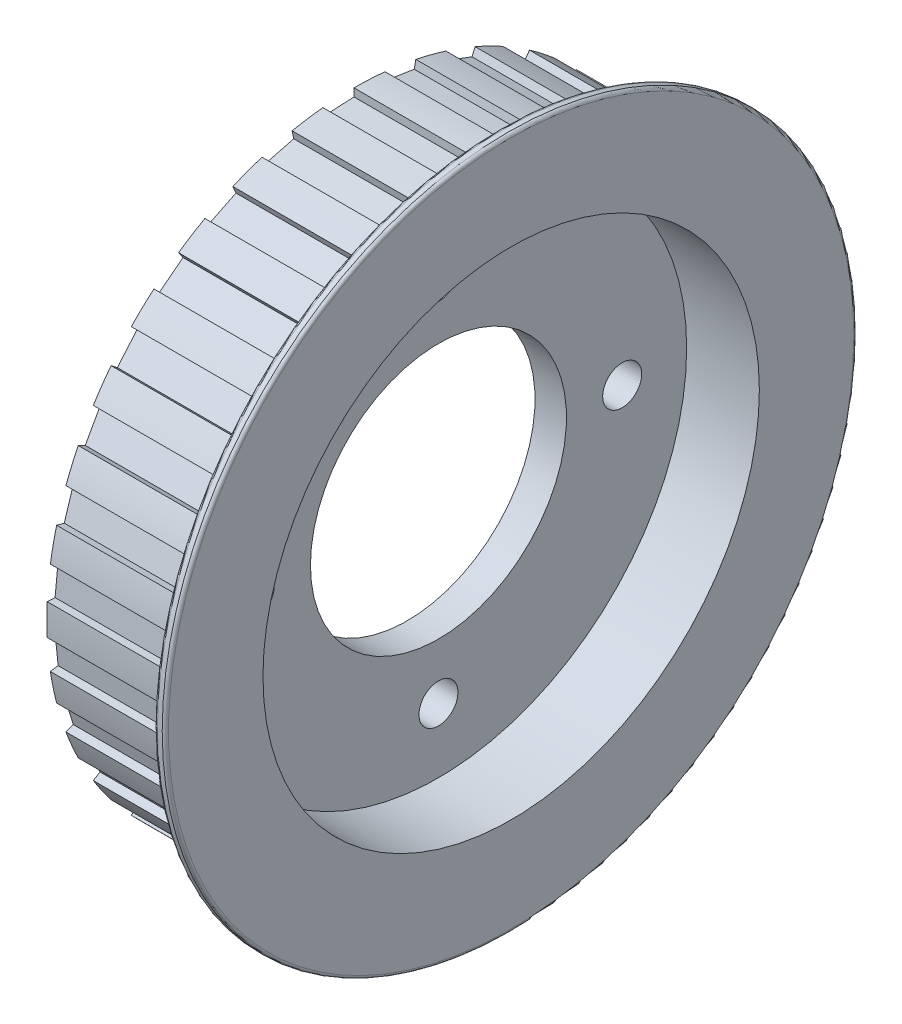
from build123d import *

# Parameters (mm, degrees)
BOSS_EXTRUDE1_START           = -0.79375
BOSS_EXTRUDE1_DEPTH           = 11.90625
BOSS_EXTRUDE1_START_2         = 5.55625
BOSS_EXTRUDE1_3_DEPTH         = 0.79375
SKETCH2_R                     = 27.94
BOSS_EXTRUDE2_DEPTH           = 0.79375
M36_CLEARANCE_HOLE1_D         = 40.1066
DRAFT1_ANGLE                  = 2.903225806
DRAFT2_ANGLE                  = 2.903225806
SKETCH6_W                     = 5.87375
SKETCH6_H                     = 6.962175295
SKETCH10_R                    = 20.0533
BOSS_EXTRUDE3_DEPTH           = 2.54
FILLET2_R                     = 0.0635
FILLET3_R                     = 0.254
RIM_START                     = -4.28625
RIM_RELIEF_SKETCH_R           = 20.7645
RIM_RELIEF_SKETCH_R_2         = 20.0533
RIM_RELIEF_CUT_DEPTH          = 4.28625
BOLT_HEAD_CLEARANCE_SKETCH_R  = 1.575
BOLT_HEAD_CLEARANCE_CUT_DEPTH = 42.503960762
BORE_SKETCH_R                 = 10.343388
BORE_CUT_DEPTH                = 42.503960762


with BuildPart() as part:
    # Boss-Extrude1: read off the stored shape, not the designer's step
    # Boss-Extrude1 outline → Boss-Extrude1 (new body)
    with BuildSketch(Plane.ZY.offset(-5.55625).offset(BOSS_EXTRUDE1_START)):
        with BuildLine():
            Line((-22.675596757, -8.398118858), (-21.70963201, -10.6490829))
            Line((-21.70963201, -10.6490829), (-22.279737893, -10.928733186))
            ThreePointArc((-22.279737893, -10.928733186), (-21.697610757, -12.043156442), (-21.059786165, -13.126665087))
            Line((-21.059786165, -13.126665087), (-20.520897062, -12.790772941))
            Line((-20.520897062, -12.790772941), (-19.12158994, -14.801212343))
            Line((-19.12158994, -14.801212343), (-19.623732533, -15.189899642))
            ThreePointArc((-19.623732533, -15.189899642), (-18.829189821, -16.164329257), (-17.986312849, -17.09726527))
            Line((-17.986312849, -17.09726527), (-17.526069429, -16.659771277))
            Line((-17.526069429, -16.659771277), (-15.75070773, -18.347378413))
            Line((-15.75070773, -18.347378413), (-16.164329257, -18.829189821))
            ThreePointArc((-16.164329257, -18.829189821), (-15.189899642, -19.623732533), (-14.176477772, -20.367901404))
            Line((-14.176477772, -20.367901404), (-13.813722456, -19.846716619))
            Line((-13.813722456, -19.846716619), (-11.734989696, -21.142400656))
            Line((-11.734989696, -21.142400656), (-12.043156442, -21.697610757))
            ThreePointArc((-12.043156442, -21.697610757), (-10.928733186, -22.279737893), (-9.786256029, -22.804673262))
            Line((-9.786256029, -22.804673262), (-9.535840061, -22.221135051))
            Line((-9.535840061, -22.221135051), (-7.238839804, -23.071850531))
            Line((-7.238839804, -23.071850531), (-7.428935387, -23.677728959))
            ThreePointArc((-7.428935387, -23.677728959), (-6.22014311, -24.023608166), (-4.995383815, -24.307819116))
            Line((-4.995383815, -24.307819116), (-4.867559255, -23.685817603))
            Line((-4.867559255, -23.685817603), (-2.44633096, -24.056736135))
            Line((-2.44633096, -24.056736135), (-2.510572845, -24.688478155))
            ThreePointArc((-2.510572845, -24.688478155), (-1.256899644, -24.783949099), (0, -24.8158))
            Line((0, -24.8158), (0, -24.1808))
            Line((0, -24.1808), (2.458947022, -24.1808))
            Line((2.458947022, -24.1808), (2.510572845, -24.688478155))
            ThreePointArc((2.510572845, -24.688478155), (3.757801441, -24.529632243), (4.995383815, -24.307819116))
            Line((4.995383815, -24.307819116), (4.867559255, -23.685817603))
            Line((4.867559255, -23.685817603), (7.238839804, -23.071850531))
            Line((7.238839804, -23.071850531), (7.428935387, -23.677728959))
            ThreePointArc((7.428935387, -23.677728959), (8.618657693, -23.271069361), (9.786256029, -22.804673262))
            Line((9.786256029, -22.804673262), (9.535840061, -22.221135051))
            Line((9.535840061, -22.221135051), (11.734989696, -21.142400656))
            Line((11.734989696, -21.142400656), (12.043156442, -21.697610757))
            ThreePointArc((12.043156442, -21.697610757), (13.126665087, -21.059786165), (14.176477772, -20.367901404))
            Line((14.176477772, -20.367901404), (13.813722456, -19.846716619))
            Line((13.813722456, -19.846716619), (15.75070773, -18.347378413))
            Line((15.75070773, -18.347378413), (16.164329257, -18.829189821))
            ThreePointArc((16.164329257, -18.829189821), (17.09726527, -17.986312849), (17.986312849, -17.09726527))
            Line((17.986312849, -17.09726527), (17.526069429, -16.659771277))
            Line((17.526069429, -16.659771277), (19.12158994, -14.801212343))
            Line((19.12158994, -14.801212343), (19.623732533, -15.189899642))
            ThreePointArc((19.623732533, -15.189899642), (20.367901404, -14.176477772), (21.059786165, -13.126665087))
            Line((21.059786165, -13.126665087), (20.520897062, -12.790772941))
            Line((20.520897062, -12.790772941), (21.70963201, -10.6490829))
            Line((21.70963201, -10.6490829), (22.279737893, -10.928733186))
            ThreePointArc((22.279737893, -10.928733186), (22.804673262, -9.78625603), (23.271069361, -8.618657694))
            Line((23.271069361, -8.618657694), (22.675596757, -8.398118858))
            Line((22.675596757, -8.398118858), (23.408879196, -6.060978752))
            Line((23.408879196, -6.060978752), (24.023608166, -6.22014311))
            ThreePointArc((24.023608166, -6.22014311), (24.307819116, -4.995383815), (24.529632243, -3.757801441))
            Line((24.529632243, -3.757801441), (23.901954857, -3.661644802))
            Line((23.901954857, -3.661644802), (24.149764117, -1.224737422))
            Line((24.149764117, -1.224737422), (24.783949099, -1.256899644))
            ThreePointArc((24.783949099, -1.256899644), (24.8158, 0), (24.783949099, 1.256899644))
            Line((24.783949099, 1.256899644), (24.149764117, 1.224737422))
            Line((24.149764117, 1.224737422), (23.901954857, 3.661644802))
            Line((23.901954857, 3.661644802), (24.529632243, 3.757801441))
            ThreePointArc((24.529632243, 3.757801441), (24.307819116, 4.995383815), (24.023608166, 6.22014311))
            Line((24.023608166, 6.22014311), (23.408879196, 6.060978752))
            Line((23.408879196, 6.060978752), (22.675596757, 8.398118858))
            Line((22.675596757, 8.398118858), (23.271069361, 8.618657694))
            ThreePointArc((23.271069361, 8.618657694), (22.804673262, 9.78625603), (22.279737893, 10.928733186))
            Line((22.279737893, 10.928733186), (21.70963201, 10.6490829))
            Line((21.70963201, 10.6490829), (20.520897062, 12.790772941))
            Line((20.520897062, 12.790772941), (21.059786165, 13.126665087))
            ThreePointArc((21.059786165, 13.126665087), (20.367901404, 14.176477772), (19.623732533, 15.189899642))
            Line((19.623732533, 15.189899642), (19.12158994, 14.801212343))
            Line((19.12158994, 14.801212343), (17.526069429, 16.659771277))
            Line((17.526069429, 16.659771277), (17.986312849, 17.09726527))
            ThreePointArc((17.986312849, 17.09726527), (17.09726527, 17.986312849), (16.164329257, 18.829189821))
            Line((16.164329257, 18.829189821), (15.75070773, 18.347378413))
            Line((15.75070773, 18.347378413), (13.813722456, 19.846716619))
            Line((13.813722456, 19.846716619), (14.176477772, 20.367901404))
            ThreePointArc((14.176477772, 20.367901404), (13.126665087, 21.059786165), (12.043156442, 21.697610757))
            Line((12.043156442, 21.697610757), (11.734989696, 21.142400656))
            Line((11.734989696, 21.142400656), (9.535840061, 22.221135051))
            Line((9.535840061, 22.221135051), (9.786256029, 22.804673262))
            ThreePointArc((9.786256029, 22.804673262), (8.618657693, 23.271069361), (7.428935387, 23.677728959))
            Line((7.428935387, 23.677728959), (7.238839804, 23.071850531))
            Line((7.238839804, 23.071850531), (4.867559255, 23.685817603))
            Line((4.867559255, 23.685817603), (4.995383815, 24.307819116))
            ThreePointArc((4.995383815, 24.307819116), (3.757801441, 24.529632243), (2.510572845, 24.688478155))
            Line((2.510572845, 24.688478155), (2.458947022, 24.1808))
            Line((2.458947022, 24.1808), (0, 24.1808))
            Line((0, 24.1808), (0, 24.8158))
            ThreePointArc((0, 24.8158), (-1.256899644, 24.783949099), (-2.510572845, 24.688478155))
            Line((-2.510572845, 24.688478155), (-2.44633096, 24.056736135))
            Line((-2.44633096, 24.056736135), (-4.867559255, 23.685817603))
            Line((-4.867559255, 23.685817603), (-4.995383815, 24.307819116))
            ThreePointArc((-4.995383815, 24.307819116), (-6.22014311, 24.023608166), (-7.428935387, 23.677728959))
            Line((-7.428935387, 23.677728959), (-7.238839804, 23.071850531))
            Line((-7.238839804, 23.071850531), (-9.535840061, 22.221135051))
            Line((-9.535840061, 22.221135051), (-9.786256029, 22.804673262))
            ThreePointArc((-9.786256029, 22.804673262), (-10.928733186, 22.279737893), (-12.043156442, 21.697610757))
            Line((-12.043156442, 21.697610757), (-11.734989696, 21.142400656))
            Line((-11.734989696, 21.142400656), (-13.813722456, 19.846716619))
            Line((-13.813722456, 19.846716619), (-14.176477772, 20.367901404))
            ThreePointArc((-14.176477772, 20.367901404), (-15.189899642, 19.623732533), (-16.164329257, 18.829189821))
            Line((-16.164329257, 18.829189821), (-15.75070773, 18.347378413))
            Line((-15.75070773, 18.347378413), (-17.526069429, 16.659771277))
            Line((-17.526069429, 16.659771277), (-17.986312849, 17.09726527))
            ThreePointArc((-17.986312849, 17.09726527), (-18.829189821, 16.164329257), (-19.623732533, 15.189899642))
            Line((-19.623732533, 15.189899642), (-19.12158994, 14.801212343))
            Line((-19.12158994, 14.801212343), (-20.520897062, 12.790772941))
            Line((-20.520897062, 12.790772941), (-21.059786165, 13.126665087))
            ThreePointArc((-21.059786165, 13.126665087), (-21.697610757, 12.043156442), (-22.279737893, 10.928733186))
            Line((-22.279737893, 10.928733186), (-21.70963201, 10.6490829))
            Line((-21.70963201, 10.6490829), (-22.675596757, 8.398118858))
            Line((-22.675596757, 8.398118858), (-23.271069361, 8.618657694))
            ThreePointArc((-23.271069361, 8.618657694), (-23.677728959, 7.428935387), (-24.023608166, 6.22014311))
            Line((-24.023608166, 6.22014311), (-23.408879196, 6.060978752))
            Line((-23.408879196, 6.060978752), (-23.901954857, 3.661644802))
            Line((-23.901954857, 3.661644802), (-24.529632243, 3.757801441))
            ThreePointArc((-24.529632243, 3.757801441), (-24.688478155, 2.510572845), (-24.783949099, 1.256899644))
            Line((-24.783949099, 1.256899644), (-24.149764117, 1.224737422))
            Line((-24.149764117, 1.224737422), (-24.149764117, -1.224737422))
            Line((-24.149764117, -1.224737422), (-24.783949099, -1.256899644))
            ThreePointArc((-24.783949099, -1.256899644), (-24.688478155, -2.510572845), (-24.529632243, -3.757801441))
            Line((-24.529632243, -3.757801441), (-23.901954857, -3.661644802))
            Line((-23.901954857, -3.661644802), (-23.408879196, -6.060978752))
            Line((-23.408879196, -6.060978752), (-24.023608166, -6.22014311))
            ThreePointArc((-24.023608166, -6.22014311), (-23.677728959, -7.428935387), (-23.271069361, -8.618657694))
            Line((-23.271069361, -8.618657694), (-22.675596757, -8.398118858))
        make_face()
    extrude(amount=BOSS_EXTRUDE1_DEPTH)

    # Boss-Extrude1 2 outline → Boss-Extrude1 2 (revolve)
    with BuildSketch(Plane.YX):
        with BuildLine():
            Line((24.807158221, 6.35), (24.807158221, 5.55625))
            Line((24.807158221, 5.55625), (24.8158, 5.55625))
            ThreePointArc((24.8158, 5.55625), (26.427527699, 5.757790377), (27.94, 6.35))
            Line((27.94, 6.35), (24.807158221, 6.35))
        make_face()
    revolve(axis=Axis((0, 0, 0), (1, 0, 0)))

    # Boss-Extrude1 3 outline → Boss-Extrude1 3 (add)
    with BuildSketch(Plane.YZ.offset(BOSS_EXTRUDE1_START_2)):
        with BuildLine():
            Line((24.1808, 0), (24.807158221, 0))
            ThreePointArc((24.807158221, 0), (24.775318411, 1.256461945), (24.679880715, 2.509698571))
            Line((24.679880715, 2.509698571), (24.1808, 2.458947022))
            Line((24.1808, 2.458947022), (24.1808, 0))
        make_face()
        with BuildLine():
            Line((23.685817603, 4.867559255), (24.299354235, 4.993644238))
            ThreePointArc((24.299354235, 4.993644238), (24.015242258, 6.217977026), (23.669483498, 7.426348357))
            Line((23.669483498, 7.426348357), (23.071850531, 7.238839804))
            Line((23.071850531, 7.238839804), (23.685817603, 4.867559255))
        make_face()
        with BuildLine():
            Line((22.221135051, 9.535840061), (22.796731831, 9.782848093))
            ThreePointArc((22.796731831, 9.782848093), (22.271979265, 10.924927397), (21.690054847, 12.03896257))
            Line((21.690054847, 12.03896257), (21.142400656, 11.734989696))
            Line((21.142400656, 11.734989696), (22.221135051, 9.535840061))
        make_face()
        with BuildLine():
            Line((19.846716619, 13.813722456), (20.360808548, 14.171540999))
            ThreePointArc((20.360808548, 14.171540999), (19.616898823, 15.184609957), (18.822632801, 16.15870024))
            Line((18.822632801, 16.15870024), (18.347378413, 15.75070773))
            Line((18.347378413, 15.75070773), (19.846716619, 13.813722456))
        make_face()
        with BuildLine():
            Line((16.659771277, 17.526069429), (17.091311371, 17.98004935))
            ThreePointArc((17.091311371, 17.98004935), (16.15870024, 18.822632801), (15.184609957, 19.616898824))
            Line((15.184609957, 19.616898824), (14.801212343, 19.12158994))
            Line((14.801212343, 19.12158994), (16.659771277, 17.526069429))
        make_face()
        with BuildLine():
            Line((12.790772941, 20.520897062), (13.122093897, 21.052452369))
            ThreePointArc((13.122093897, 21.052452369), (12.038962569, 21.690054847), (10.924927397, 22.271979265))
            Line((10.924927397, 22.271979265), (10.6490829, 21.70963201))
            Line((10.6490829, 21.70963201), (12.790772941, 20.520897062))
        make_face()
        with BuildLine():
            Line((8.398118858, 22.675596757), (8.615656359, 23.262965514))
            ThreePointArc((8.615656359, 23.262965514), (7.426348357, 23.669483498), (6.217977026, 24.015242258))
            Line((6.217977026, 24.015242258), (6.060978752, 23.408879196))
            Line((6.060978752, 23.408879196), (8.398118858, 22.675596757))
        make_face()
        with BuildLine():
            Line((3.661644802, 23.901954857), (3.756492836, 24.521090118))
            ThreePointArc((3.756492836, 24.521090118), (2.509698571, 24.679880715), (1.256461945, 24.775318411))
            Line((1.256461945, 24.775318411), (1.224737422, 24.149764117))
            Line((1.224737422, 24.149764117), (3.661644802, 23.901954857))
        make_face()
        with BuildLine():
            Line((-1.224737422, 24.149764117), (-1.256461945, 24.775318411))
            ThreePointArc((-1.256461945, 24.775318411), (-2.509698571, 24.679880715), (-3.756492836, 24.521090118))
            Line((-3.756492836, 24.521090118), (-3.661644802, 23.901954857))
            Line((-3.661644802, 23.901954857), (-1.224737422, 24.149764117))
        make_face()
        with BuildLine():
            Line((-6.060978752, 23.408879196), (-6.217977026, 24.015242258))
            ThreePointArc((-6.217977026, 24.015242258), (-7.426348357, 23.669483498), (-8.615656359, 23.262965514))
            Line((-8.615656359, 23.262965514), (-8.398118858, 22.675596757))
            Line((-8.398118858, 22.675596757), (-6.060978752, 23.408879196))
        make_face()
        with BuildLine():
            Line((-10.6490829, 21.70963201), (-10.924927397, 22.271979265))
            ThreePointArc((-10.924927397, 22.271979265), (-12.038962569, 21.690054847), (-13.122093897, 21.052452369))
            Line((-13.122093897, 21.052452369), (-12.790772941, 20.520897062))
            Line((-12.790772941, 20.520897062), (-10.6490829, 21.70963201))
        make_face()
        with BuildLine():
            Line((-14.801212343, 19.12158994), (-15.184609957, 19.616898824))
            ThreePointArc((-15.184609957, 19.616898824), (-16.15870024, 18.822632801), (-17.091311371, 17.98004935))
            Line((-17.091311371, 17.98004935), (-16.659771277, 17.526069429))
            Line((-16.659771277, 17.526069429), (-14.801212343, 19.12158994))
        make_face()
        with BuildLine():
            Line((-18.347378413, 15.75070773), (-18.822632801, 16.15870024))
            ThreePointArc((-18.822632801, 16.15870024), (-19.616898823, 15.184609957), (-20.360808548, 14.171540999))
            Line((-20.360808548, 14.171540999), (-19.846716619, 13.813722456))
            Line((-19.846716619, 13.813722456), (-18.347378413, 15.75070773))
        make_face()
        with BuildLine():
            Line((-21.142400656, 11.734989696), (-21.690054847, 12.03896257))
            ThreePointArc((-21.690054847, 12.03896257), (-22.271979265, 10.924927397), (-22.796731831, 9.782848093))
            Line((-22.796731831, 9.782848093), (-22.221135051, 9.535840061))
            Line((-22.221135051, 9.535840061), (-21.142400656, 11.734989696))
        make_face()
        with BuildLine():
            Line((-23.071850531, 7.238839804), (-23.669483498, 7.426348357))
            ThreePointArc((-23.669483498, 7.426348357), (-24.015242258, 6.217977026), (-24.299354235, 4.993644238))
            Line((-24.299354235, 4.993644238), (-23.685817603, 4.867559255))
            Line((-23.685817603, 4.867559255), (-23.071850531, 7.238839804))
        make_face()
        with BuildLine():
            Line((-24.1808, 2.458947022), (-24.679880715, 2.509698571))
            ThreePointArc((-24.679880715, 2.509698571), (-24.775318411, 1.256461945), (-24.807158221, 0))
            Line((-24.807158221, 0), (-24.1808, 0))
            Line((-24.1808, 0), (-24.1808, 2.458947022))
        make_face()
        with BuildLine():
            Line((-24.056736135, -2.44633096), (-24.679880715, -2.509698571))
            ThreePointArc((-24.679880715, -2.509698571), (-24.521090118, -3.756492836), (-24.299354235, -4.993644238))
            Line((-24.299354235, -4.993644238), (-23.685817603, -4.867559255))
            Line((-23.685817603, -4.867559255), (-24.056736135, -2.44633096))
        make_face()
        with BuildLine():
            Line((-23.071850531, -7.238839804), (-23.669483498, -7.426348357))
            ThreePointArc((-23.669483498, -7.426348357), (-23.262965514, -8.615656358), (-22.796731831, -9.782848093))
            Line((-22.796731831, -9.782848093), (-22.221135051, -9.535840061))
            Line((-22.221135051, -9.535840061), (-23.071850531, -7.238839804))
        make_face()
        with BuildLine():
            Line((-21.142400656, -11.734989696), (-21.690054847, -12.03896257))
            ThreePointArc((-21.690054847, -12.03896257), (-21.052452369, -13.122093898), (-20.360808548, -14.171540999))
            Line((-20.360808548, -14.171540999), (-19.846716619, -13.813722456))
            Line((-19.846716619, -13.813722456), (-21.142400656, -11.734989696))
        make_face()
        with BuildLine():
            Line((-18.347378413, -15.75070773), (-18.822632801, -16.15870024))
            ThreePointArc((-18.822632801, -16.15870024), (-17.98004935, -17.091311371), (-17.091311371, -17.98004935))
            Line((-17.091311371, -17.98004935), (-16.659771277, -17.526069429))
            Line((-16.659771277, -17.526069429), (-18.347378413, -15.75070773))
        make_face()
        with BuildLine():
            Line((-14.801212343, -19.12158994), (-15.184609957, -19.616898824))
            ThreePointArc((-15.184609957, -19.616898824), (-14.171540998, -20.360808548), (-13.122093897, -21.052452369))
            Line((-13.122093897, -21.052452369), (-12.790772941, -20.520897062))
            Line((-12.790772941, -20.520897062), (-14.801212343, -19.12158994))
        make_face()
        with BuildLine():
            Line((-10.6490829, -21.70963201), (-10.924927397, -22.271979265))
            ThreePointArc((-10.924927397, -22.271979265), (-9.782848093, -22.796731831), (-8.615656359, -23.262965514))
            Line((-8.615656359, -23.262965514), (-8.398118858, -22.675596757))
            Line((-8.398118858, -22.675596757), (-10.6490829, -21.70963201))
        make_face()
        with BuildLine():
            Line((-6.060978752, -23.408879196), (-6.217977026, -24.015242258))
            ThreePointArc((-6.217977026, -24.015242258), (-4.993644238, -24.299354235), (-3.756492836, -24.521090118))
            Line((-3.756492836, -24.521090118), (-3.661644802, -23.901954857))
            Line((-3.661644802, -23.901954857), (-6.060978752, -23.408879196))
        make_face()
        with BuildLine():
            Line((-1.224737422, -24.149764117), (-1.256461945, -24.775318411))
            ThreePointArc((-1.256461945, -24.775318411), (0, -24.807158221), (1.256461945, -24.775318411))
            Line((1.256461945, -24.775318411), (1.224737422, -24.149764117))
            Line((1.224737422, -24.149764117), (-1.224737422, -24.149764117))
        make_face()
        with BuildLine():
            Line((3.661644802, -23.901954857), (3.756492836, -24.521090118))
            ThreePointArc((3.756492836, -24.521090118), (4.993644238, -24.299354235), (6.217977026, -24.015242258))
            Line((6.217977026, -24.015242258), (6.060978752, -23.408879196))
            Line((6.060978752, -23.408879196), (3.661644802, -23.901954857))
        make_face()
        with BuildLine():
            Line((8.398118858, -22.675596757), (8.615656359, -23.262965514))
            ThreePointArc((8.615656359, -23.262965514), (9.782848093, -22.796731831), (10.924927397, -22.271979265))
            Line((10.924927397, -22.271979265), (10.6490829, -21.70963201))
            Line((10.6490829, -21.70963201), (8.398118858, -22.675596757))
        make_face()
        with BuildLine():
            Line((12.790772941, -20.520897062), (13.122093897, -21.052452369))
            ThreePointArc((13.122093897, -21.052452369), (14.171540998, -20.360808548), (15.184609957, -19.616898824))
            Line((15.184609957, -19.616898824), (14.801212343, -19.12158994))
            Line((14.801212343, -19.12158994), (12.790772941, -20.520897062))
        make_face()
        with BuildLine():
            Line((16.659771277, -17.526069429), (17.091311371, -17.98004935))
            ThreePointArc((17.091311371, -17.98004935), (17.98004935, -17.091311371), (18.822632801, -16.15870024))
            Line((18.822632801, -16.15870024), (18.347378413, -15.75070773))
            Line((18.347378413, -15.75070773), (16.659771277, -17.526069429))
        make_face()
        with BuildLine():
            Line((19.846716619, -13.813722456), (20.360808548, -14.171540999))
            ThreePointArc((20.360808548, -14.171540999), (21.052452369, -13.122093898), (21.690054847, -12.03896257))
            Line((21.690054847, -12.03896257), (21.142400656, -11.734989696))
            Line((21.142400656, -11.734989696), (19.846716619, -13.813722456))
        make_face()
        with BuildLine():
            Line((22.221135051, -9.535840061), (22.796731831, -9.782848093))
            ThreePointArc((22.796731831, -9.782848093), (23.262965514, -8.615656358), (23.669483498, -7.426348357))
            Line((23.669483498, -7.426348357), (23.071850531, -7.238839804))
            Line((23.071850531, -7.238839804), (22.221135051, -9.535840061))
        make_face()
        with BuildLine():
            Line((23.685817603, -4.867559255), (24.299354235, -4.993644238))
            ThreePointArc((24.299354235, -4.993644238), (24.521090118, -3.756492836), (24.679880715, -2.509698571))
            Line((24.679880715, -2.509698571), (24.056736135, -2.44633096))
            Line((24.056736135, -2.44633096), (23.685817603, -4.867559255))
        make_face()
    extrude(amount=BOSS_EXTRUDE1_3_DEPTH)

    # Sketch2 → Boss-Extrude2 (add)
    with BuildSketch(Plane(origin=(6.35, 0, 0), x_dir=(0, 0, -1), z_dir=(1, 0, 0))):
        Circle(SKETCH2_R)
    extrude(amount=BOSS_EXTRUDE2_DEPTH)

    # M36 Clearance Hole1 (through all)
    with Locations(Plane.ZY.offset(5.55625)):
        with Locations((0, 0)):
            Hole(M36_CLEARANCE_HOLE1_D / 2)

    # Draft1
    draft1_faces = [part.faces().sort_by_distance(p)[0] for p in [
        (0, -24.1808, 1.229473511),
    ]]
    draft(draft1_faces, Plane(origin=(-5.55625, -24.1808, 0), x_dir=(1, 0, 0), z_dir=(0, 0, 1)), DRAFT1_ANGLE)

    # Draft2
    draft2_faces = [part.faces().sort_by_distance(p)[0] for p in [
        (0, 24.1808, 1.229473511),
    ]]
    draft(draft2_faces, Plane(origin=(-5.55625, 24.8158, 0), x_dir=(0, 1, 0), z_dir=(0, 0, 1)), DRAFT2_ANGLE)

    # Sketch10 → Boss-Extrude3 (add)
    with BuildSketch(Plane.ZY.offset(-1.27)):
        Circle(SKETCH10_R)
    extrude(amount=BOSS_EXTRUDE3_DEPTH)

    # Fillet2
    fillet2_edges = [part.edges().sort_by_distance(p)[0] for p in [
        (0, -6.060978752, -23.408879196),
    ]]
    fillet(fillet2_edges, radius=FILLET2_R)

    # Fillet3
    fillet3_edges = [part.edges().sort_by_distance(p)[0] for p in [
        (6.35, -19.756563466, 19.756563466),
        (7.14375, 0, 27.94),
    ]]
    fillet(fillet3_edges, radius=FILLET3_R)

    # Rim Relief Sketch → Rim Relief Cut (cut)
    with BuildSketch(Plane.ZY.offset(5.55625).offset(RIM_START)):
        Circle(RIM_RELIEF_SKETCH_R)
        Circle(RIM_RELIEF_SKETCH_R_2, mode=Mode.SUBTRACT)
    extrude(amount=RIM_RELIEF_CUT_DEPTH, mode=Mode.SUBTRACT)

    # Bolt Head Clearance Sketch → Bolt Head Clearance Cut (cut, through all)
    with BuildSketch(Plane(origin=(7.14375, 0, 0), x_dir=(0, 0, -1), z_dir=(1, 0, 0))):
        with Locations(Location((0, 14.843252, 0), (0, 0, 180))):
            Circle(BOLT_HEAD_CLEARANCE_SKETCH_R)
        with Locations(Location((14.843252, 0, 0), (0, 0, 180))):
            Circle(BOLT_HEAD_CLEARANCE_SKETCH_R)
        with Locations(Location((0, -14.843252, 0), (0, 0, 180))):
            Circle(BOLT_HEAD_CLEARANCE_SKETCH_R)
        with Locations(Location((-14.843252, 0, 0), (0, 0, 180))):
            Circle(BOLT_HEAD_CLEARANCE_SKETCH_R)
    extrude(amount=-BOLT_HEAD_CLEARANCE_CUT_DEPTH, mode=Mode.SUBTRACT)


with BuildPart() as body_2:
    # Sketch6 → Revolve1 (revolve)
    with BuildSketch(Plane(origin=(0, 0, 0), x_dir=(-1, 0, 0), z_dir=(0, 0, -1)), mode=Mode.PRIVATE) as revolve1_sk:
        with Locations((-4.206875, 3.481087648)):
            Rectangle(SKETCH6_W, SKETCH6_H)
    revolve(revolve1_sk.sketch.rotate(Axis((7.14375, 0, 0), (-1, 0, 0)), 270), axis=Axis((7.14375, 0, 0), (-1, 0, 0)))


with BuildPart() as bore_cut_tool:
    # Bore Sketch → Bore Cut (new, through all)
    with BuildSketch(Plane(origin=(7.14375, 0, 0), x_dir=(0, 0, -1), z_dir=(1, 0, 0))):
        with Locations(Location((0, 0, 0), (0, 0, 180))):
            Circle(BORE_SKETCH_R)
    extrude(amount=-BORE_CUT_DEPTH)


with BuildPart() as part_1:
    add(part.part)

    # Bore Cut: cut by bore_cut_tool
    add(bore_cut_tool.part, mode=Mode.SUBTRACT)


with BuildPart() as body_2_1:
    add(body_2.part)

    # Bore Cut: cut by bore_cut_tool
    add(bore_cut_tool.part, mode=Mode.SUBTRACT)


solid = part_1.part
